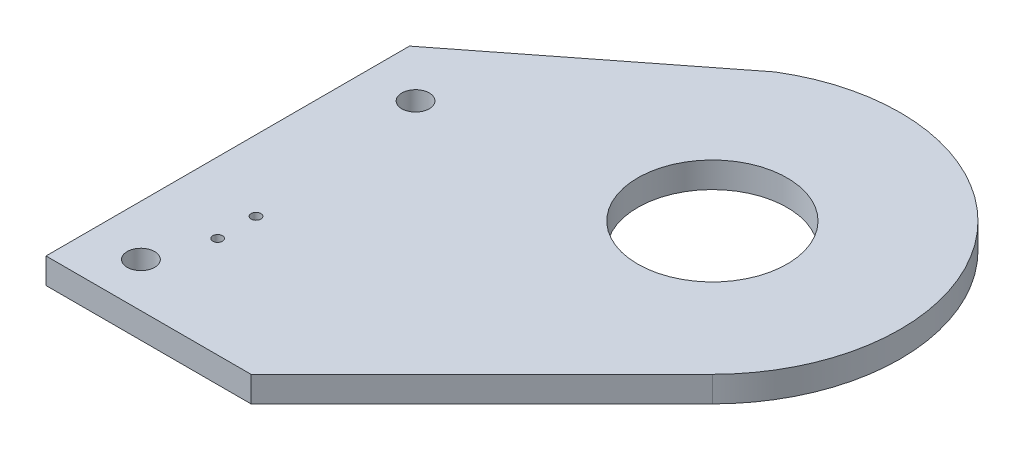
from build123d import *

# Parameters (mm, degrees)
BASE_FLANGE1_DEPTH = 6.35
SKETCH8_R          = 3.4
CUT_EXTRUDE1_DEPTH = 183.851914127
SKETCH9_R          = 18.5
CUT_EXTRUDE2_DEPTH = 183.851914127
SKETCH11_R         = 1.2
CUT_EXTRUDE4_DEPTH = 183.851914127


# Sheet-metal steps are written as plain solids
with BuildPart() as part:
    # Sketch2 → Base-Flange1 (new body)
    with BuildSketch(Plane(origin=(0, 0, 0), x_dir=(1, 0, 0), z_dir=(0, 1, 0))):
        with BuildLine():
            Line((0, 0), (50.76093065, 0))
            Line((50.76093065, 0), (107.880465325, 57.119534675))
            ThreePointArc((107.880465325, 57.119534675), (111.537953618, 118.761570635), (50.76093065, 129.682710556))
            Line((50.76093065, 129.682710556), (0, 90))
            Line((0, 90), (0, 0))
        make_face()
    extrude(amount=-BASE_FLANGE1_DEPTH)

    # Sketch8 → Cut-Extrude1 (cut, through all)
    with BuildSketch(Plane(origin=(0, 0, 0), x_dir=(1, 0, 0), z_dir=(0, 1, 0))):
        with Locations(Location((12.5, 79, 0), (0, 0, 270))):
            Circle(SKETCH8_R)
        with Locations(Location((12.5, 11, 0), (0, 0, 90))):
            Circle(SKETCH8_R)
    extrude(amount=-CUT_EXTRUDE1_DEPTH, mode=Mode.SUBTRACT)

    # Sketch9 → Cut-Extrude2 (cut, through all)
    with BuildSketch(Plane(origin=(0, 0, 0), x_dir=(1, 0, 0), z_dir=(0, 1, 0))):
        with Locations(Location((75, 90, 0), (0, 0, 270))):
            Circle(SKETCH9_R)
    extrude(amount=-CUT_EXTRUDE2_DEPTH, mode=Mode.SUBTRACT)

    # Sketch11 → Cut-Extrude4 (cut, through all)
    with BuildSketch(Plane(origin=(0, 0, 0), x_dir=(1, 0, 0), z_dir=(0, 1, 0))):
        with Locations(Location((17.5, 25, 0), (0, 0, 270))):
            Circle(SKETCH11_R)
        with Locations(Location((17.5, 34.5, 0), (0, 0, 270))):
            Circle(SKETCH11_R)
    extrude(amount=-CUT_EXTRUDE4_DEPTH, mode=Mode.SUBTRACT)


solid = part.part
